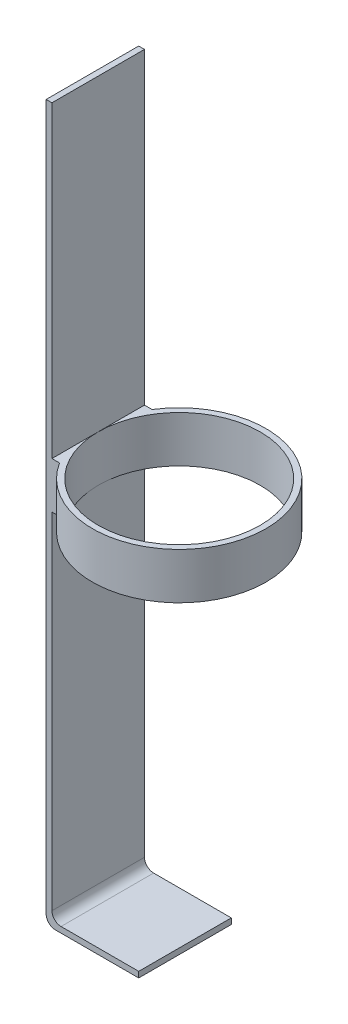
from build123d import *

# Parameters (mm, degrees)
BOSS_EXTRUDE1_DEPTH = 50.8
SKETCH2_R           = 44.45
BOSS_EXTRUDE3_DEPTH = 25.4


with BuildPart() as part:
    # Sketch1 → Boss-Extrude1 (new body)
    with BuildSketch(Plane.XY):
        with BuildLine():
            Line((3.175, 0), (0, 0))
            Line((0, 0), (0, -387.1625))
            ThreePointArc((0, -387.1625), (1.464466094, -390.698033906), (5, -392.1625))
            Line((5, -392.1625), (50.8, -392.1625))
            Line((50.8, -392.1625), (50.8, -388.9875))
            Line((50.8, -388.9875), (8.175, -388.9875))
            ThreePointArc((8.175, -388.9875), (4.639466094, -387.523033906), (3.175, -383.9875))
            Line((3.175, -383.9875), (3.175, 0))
        make_face()
    extrude(amount=BOSS_EXTRUDE1_DEPTH)

    # Sketch2 → Boss-Extrude3 (add)
    with BuildSketch(Plane(origin=(0, -194.49375, 0), x_dir=(1, 0, 0), z_dir=(0, 1, 0))):
        with BuildLine():
            Line((3.175, -42.497898263), (3.175, -50.8))
            Line((3.175, -50.8), (7.338766309, -50.8))
            ThreePointArc((7.338766309, -50.8), (95.25, -25.4), (7.338766309, 0))
            Line((7.338766309, 0), (3.175, 0))
            Line((3.175, 0), (3.175, -8.302101737))
            ThreePointArc((3.175, -8.302101737), (0, -25.4), (3.175, -42.497898263))
        make_face()
        with Locations((47.625, -25.4)):
            Circle(SKETCH2_R, mode=Mode.SUBTRACT)
    extrude(amount=BOSS_EXTRUDE3_DEPTH)


solid = part.part
